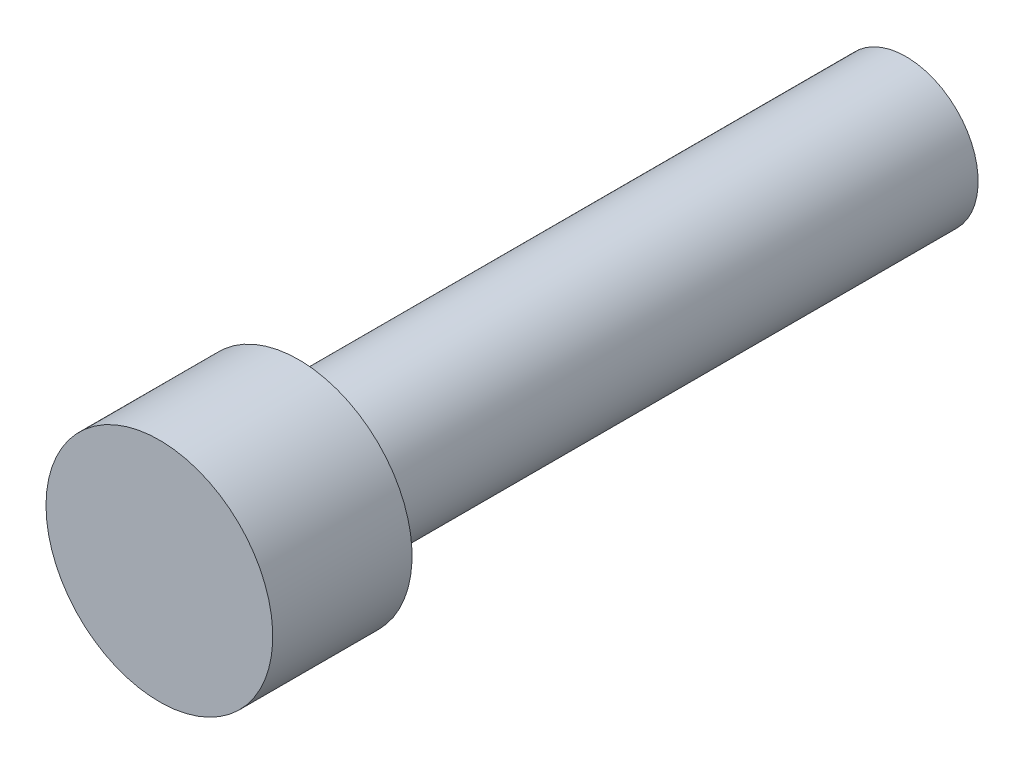
from build123d import *

# Parameters (mm, degrees)
SKETCH1_R         = 1.778
EXTRUDE1_DEPTH    = 11.7094
SKETCH3_OUTSIDE_W = 8.104
SKETCH3_OUTSIDE_H = 8.104
SKETCH3_OUTSIDE_R = 1.1303
EXTRUDE2_DEPTH    = 9.525


with BuildPart() as part:
    # Sketch1 → Extrude1 (new body)
    with BuildSketch(Plane.XY):
        Circle(SKETCH1_R)
    extrude(amount=EXTRUDE1_DEPTH)

    # Sketch3 outside → Extrude2 (cut)
    with BuildSketch(Plane(origin=(0, 0, 0), x_dir=(-1, 0, 0), z_dir=(0, 0, -1))):
        Rectangle(SKETCH3_OUTSIDE_W, SKETCH3_OUTSIDE_H)
        Circle(SKETCH3_OUTSIDE_R, mode=Mode.SUBTRACT)
    extrude(amount=-EXTRUDE2_DEPTH, mode=Mode.SUBTRACT)


solid = part.part
